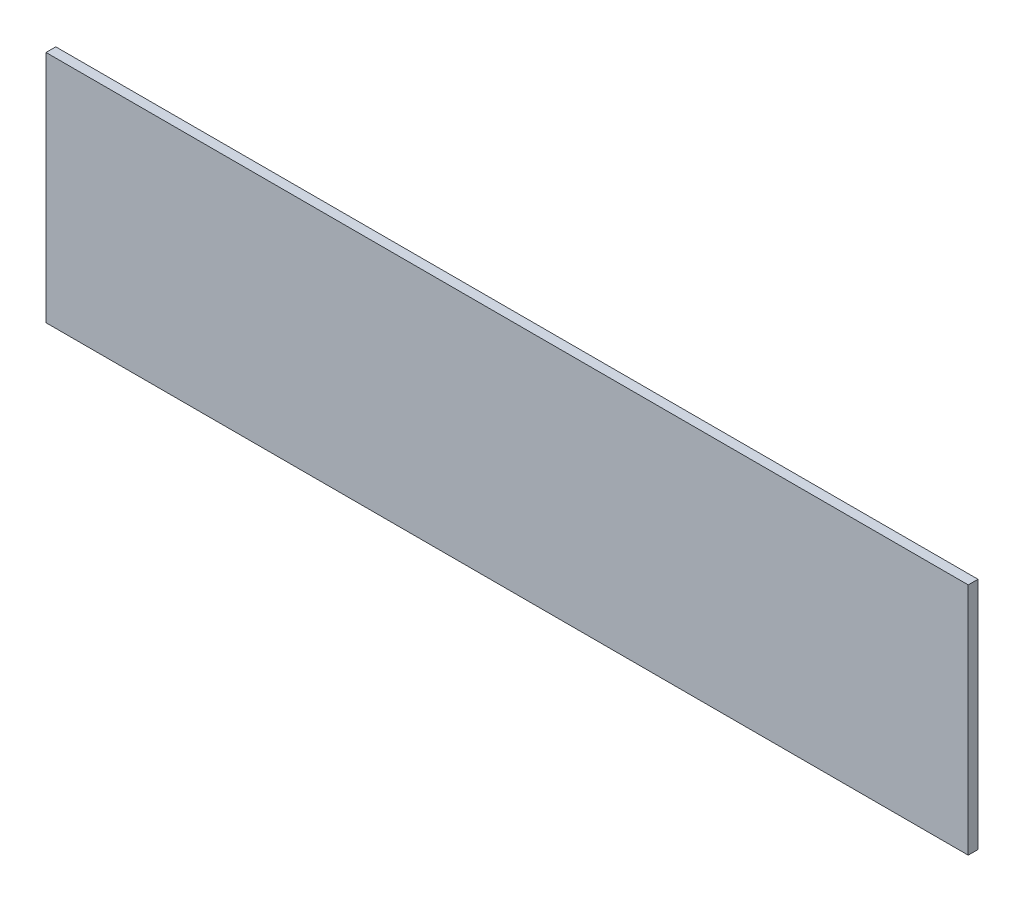
from build123d import *

# Parameters (mm, degrees)
SKETCH1_W           = 299.7
SKETCH1_H           = 76.075
BOSS_EXTRUDE1_DEPTH = 3.175


with BuildPart() as part:
    # Sketch1 → Boss-Extrude1 (new body)
    with BuildSketch(Plane.XY):
        Rectangle(SKETCH1_W, SKETCH1_H)
    extrude(amount=BOSS_EXTRUDE1_DEPTH)


solid = part.part
